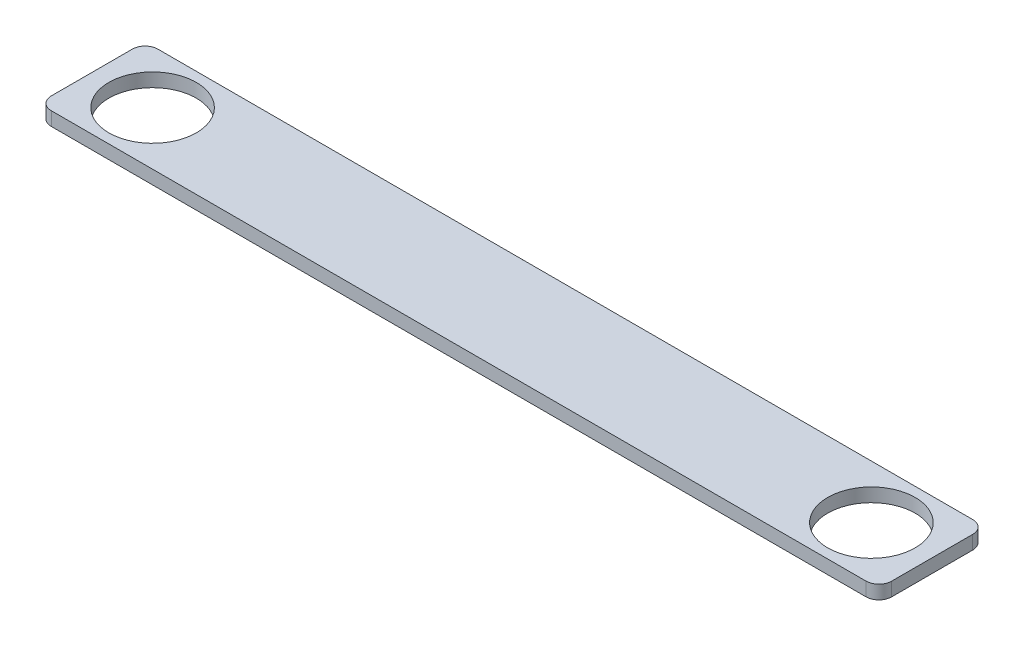
from build123d import *

# Parameters (mm, degrees)
SKETCH1_W           = 197
SKETCH1_H           = 25
SKETCH1_R           = 10.25
BOSS_EXTRUDE1_DEPTH = 3.2
FILLET1_R           = 3


with BuildPart() as part:
    # Sketch1 → Boss-Extrude1 (new body)
    with BuildSketch(Plane(origin=(0, 0, 0), x_dir=(1, 0, 0), z_dir=(0, 1, 0))):
        with Locations((-53.132, 0)):
            Rectangle(SKETCH1_W, SKETCH1_H)
        with Locations(Location((31.118, 0, 0), (0, 0, 270))):
            Circle(SKETCH1_R, mode=Mode.SUBTRACT)
        with Locations(Location((-137.382, 0, 0), (0, 0, 270))):
            Circle(SKETCH1_R, mode=Mode.SUBTRACT)
    extrude(amount=BOSS_EXTRUDE1_DEPTH)

    # Fillet1
    fillet1_edges = [part.edges().sort_by_distance(p)[0] for p in [
        (45.368, 1.6, -12.5),
        (45.368, 1.6, 12.5),
        (-151.632, 1.6, 12.5),
        (-151.632, 1.6, -12.5),
    ]]
    fillet(fillet1_edges, radius=FILLET1_R)


solid = part.part
